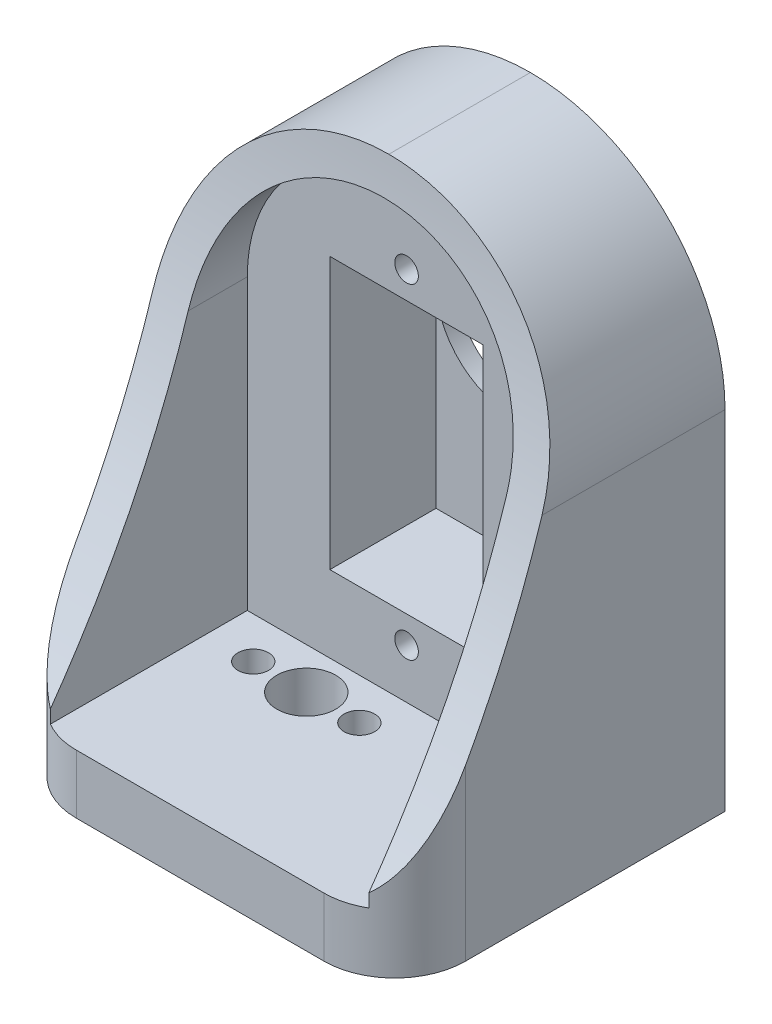
from build123d import *

# Parameters (mm, degrees)
SKETCH1_W           = 33
SKETCH1_H           = 28
BOSS_EXTRUDE1_DEPTH = 46
SKETCH2_W           = 17.5
SKETCH2_H           = 41
CUT_EXTRUDE1_DEPTH  = 46
BOSS_EXTRUDE2_DEPTH = 3
BOSS_EXTRUDE3_DEPTH = 27
FILLET1_START       = -3.5
FILLET1_DEPTH       = 5.015993094
FILLET1_START_2     = -13.5
FILLET1_2_DEPTH     = 27
FILLET2_R           = 16.5
FILLET3_R           = 6
SKETCH5_W           = 13
SKETCH5_H           = 23
CUT_EXTRUDE4_DEPTH  = 9
SKETCH6_R           = 6.5
CUT_EXTRUDE5_DEPTH  = 9
SKETCH7_R           = 1
CUT_EXTRUDE6_DEPTH  = 8
SKETCH8_R           = 1.3
SKETCH8_R_2         = 2.5
CUT_EXTRUDE7_DEPTH  = 47.360004936


with BuildPart() as part:
    # Sketch1 → Boss-Extrude1 (new body)
    with BuildSketch(Plane(origin=(0, 0, 0), x_dir=(1, 0, 0), z_dir=(0, 1, 0))):
        Rectangle(SKETCH1_W, SKETCH1_H)
    extrude(amount=BOSS_EXTRUDE1_DEPTH)

    # Sketch2 → Cut-Extrude1 (cut)
    with BuildSketch(Plane(origin=(16.5, 0, 0), x_dir=(0, 0, -1), z_dir=(1, 0, 0))):
        with Locations((-5.25, 25.5)):
            Rectangle(SKETCH2_W, SKETCH2_H)
    extrude(amount=-CUT_EXTRUDE1_DEPTH, mode=Mode.SUBTRACT)

    # Sketch3 → Boss-Extrude2 (add)
    with BuildSketch(Plane(origin=(16.5, 0, 0), x_dir=(0, 0, -1), z_dir=(1, 0, 0))):
        with BuildLine():
            Line((3.5, 46), (2, 46))
            add(Edge.make_bspline(
                [(-14, 5), (-0.68227026, 23.158489921), (2, 46)],
                knots=[0, 0, 0, 1, 1, 1], degree=2))
            Line((-14, 5), (3.5, 5))
            Line((3.5, 5), (3.5, 46))
        make_face()
    boss_extrude2 = extrude(amount=-BOSS_EXTRUDE2_DEPTH)

    # Mirror1: Boss-Extrude2 across plane
    add(boss_extrude2.mirror(Plane(origin=(0, 0, 0), x_dir=(0, 0, 1), z_dir=(1, 0, 0))))

    # Sketch4 → Boss-Extrude3 (add)
    with BuildSketch(Plane.ZY.offset(-13.5)):
        with BuildLine():
            Line((-3.5, 46), (-3.5, 43))
            Line((-3.5, 43), (-1.598813094, 43))
            add(Edge.make_bspline(
                [(-1.598813094, 43), (-1.82265352, 44.489763885), (-2.000000005, 46.000000046)],
                knots=[0.933881948, 0.933881948, 0.933881948, 1, 1, 1], degree=2))
            Line((-2.000000005, 46.000000046), (-3.5, 46))
        make_face()
    extrude(amount=BOSS_EXTRUDE3_DEPTH)

    # Fillet1: read off the stored shape, not the designer's step
    # Fillet1 outline → Fillet1 (add)
    with BuildSketch(Plane.XY.offset(FILLET1_START)):
        with BuildLine():
            ThreePointArc((-13.5, 29.5), (-9.545941546, 39.045941546), (0, 43))
            Line((0, 43), (-13.5, 43))
            Line((-13.5, 43), (-13.5, 29.5))
        make_face()
        with BuildLine():
            ThreePointArc((0, 43), (9.545941546, 39.045941546), (13.5, 29.5))
            Line((13.5, 29.5), (13.5, 43))
            Line((13.5, 43), (0, 43))
        make_face()
    extrude(amount=FILLET1_DEPTH)

    # Fillet1 2 outline → Fillet1 2 (cut)
    with BuildSketch(Plane.YZ.offset(FILLET1_START_2)):
        with BuildLine():
            add(Edge.make_bspline(
                [(43, -1.598813094), (36.02565956, -0.550902514), (29.499999971, 1.515993003)],
                knots=[0.066118051, 0.066118051, 0.066118051, 0.375650194, 0.375650194, 0.375650194], degree=2))
            Line((43, -1.598813094), (43, 1.515993094))
            Line((43, 1.515993094), (29.499999971, 1.515993003))
        make_face()
    extrude(amount=FILLET1_2_DEPTH, mode=Mode.SUBTRACT)

    # Fillet2
    # the kernel refuses this fillet: 16.5 mm, written as the material it takes off along each edge
    with BuildSketch(Plane(origin=(16.5, 46, -55.25), x_dir=(0, -1, 0), z_dir=(0, 0, 1)), Plane(origin=(-16.5, 46, 39.25), x_dir=(0, -1, 0), z_dir=(0, 0, -1))) as fillet2_piece_1:
        with BuildLine():
            CenterArc((FILLET2_R, -FILLET2_R), FILLET2_R, 90, 90)
            Line((0, -FILLET2_R), (0, 0))
            Line((0, 0), (FILLET2_R, 0))
        make_face()
    extrude(amount=94.5, mode=Mode.SUBTRACT)

    # Fillet3
    # the kernel refuses this fillet: 6 mm, written as the material it takes off along each edge
    with BuildSketch(Plane(origin=(-16.5, -15, 14), x_dir=(1, 0, 0), z_dir=(0, 1, 0)), Plane(origin=(16.5, -15, 14), x_dir=(0, 0, -1), z_dir=(0, 1, 0))) as fillet3_piece_1:
        with BuildLine():
            CenterArc((FILLET3_R, FILLET3_R), FILLET3_R, 180, 90)
            Line((0, FILLET3_R), (0, 0))
            Line((0, 0), (FILLET3_R, 0))
        make_face()
    extrude(amount=35, mode=Mode.SUBTRACT)

    # Sketch5 → Cut-Extrude4 (cut)
    with BuildSketch(Plane.XY.offset(-3.5)):
        with Locations((0, 23)):
            Rectangle(SKETCH5_W, SKETCH5_H)
    extrude(amount=-CUT_EXTRUDE4_DEPTH, mode=Mode.SUBTRACT)

    # Sketch6 → Cut-Extrude5 (cut)
    with BuildSketch(Plane.XY.offset(-12.5)):
        with Locations((0, 28)):
            Circle(SKETCH6_R)
    extrude(amount=-CUT_EXTRUDE5_DEPTH, mode=Mode.SUBTRACT)

    # Sketch7 → Cut-Extrude6 (cut)
    with BuildSketch(Plane.XY.offset(-3.5)):
        with Locations((0, 36.8)):
            Circle(SKETCH7_R)
        with Locations((0, 9.2)):
            Circle(SKETCH7_R)
    extrude(amount=-CUT_EXTRUDE6_DEPTH, mode=Mode.SUBTRACT)

    # Sketch8 → Cut-Extrude7 (cut, through all)
    with BuildSketch(Plane(origin=(0, 5, 0), x_dir=(1, 0, 0), z_dir=(0, 1, 0))):
        with Locations(Location((-0.5, 0, 0), (0, 0, 270))):
            Circle(SKETCH8_R)
        with Locations(Location((-5, 0, 0), (0, 0, 270))):
            Circle(SKETCH8_R_2)
        with Locations(Location((-9.5, 0, 0), (0, 0, 270))):
            Circle(SKETCH8_R)
    extrude(amount=-CUT_EXTRUDE7_DEPTH, mode=Mode.SUBTRACT)


solid = part.part
